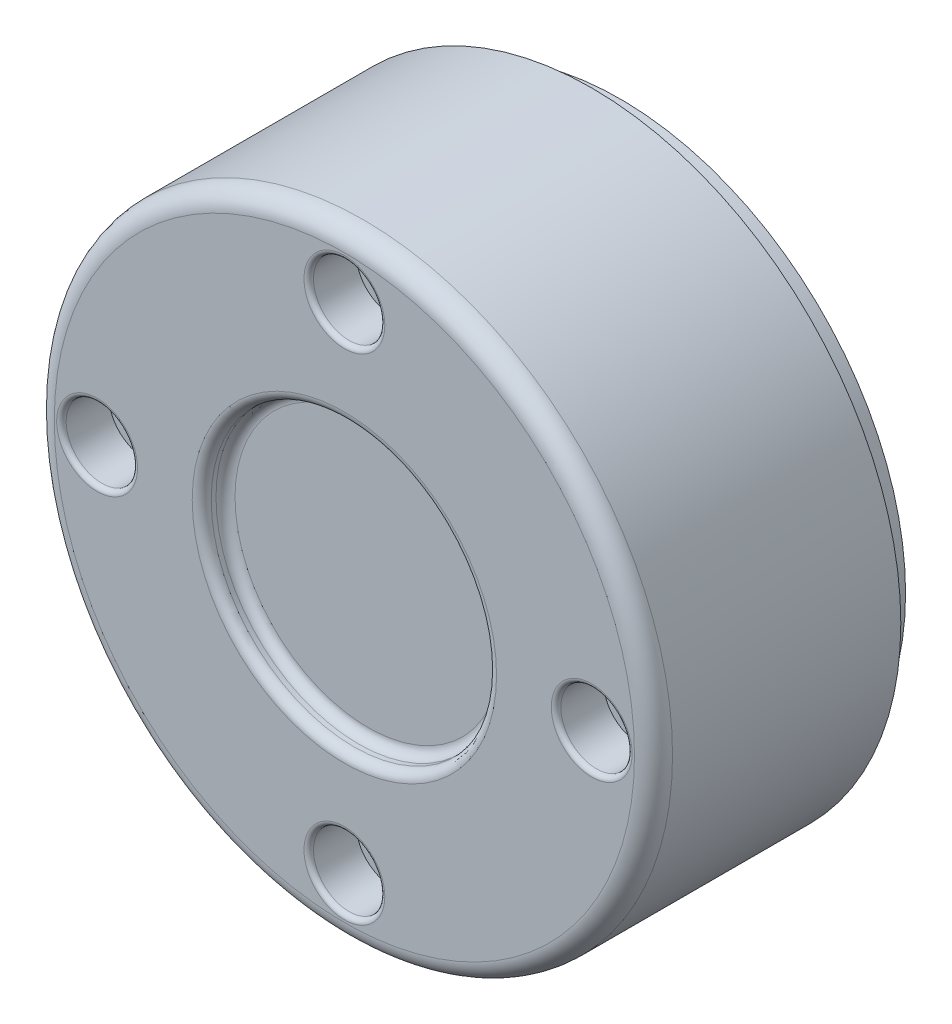
from build123d import *

# Parameters (mm, degrees)
SKETCH2_R           = 30
BOSS_EXTRUDE1_DEPTH = 3
SKETCH3_R           = 32.5
BOSS_EXTRUDE2_DEPTH = 26
SKETCH4_R           = 15
CUT_EXTRUDE1_DEPTH  = 2.5
SKETCH4_3_R         = 3.75
CUT_EXTRUDE2_DEPTH  = 5
FILLET1_R           = 1
FILLET2_R           = 1
FILLET3_R           = 2
FILLET4_R           = 0.5
SHELL1_OUTLINE_R    = 27.5
SHELL1_DEPTH        = 21.5
SHELL1_START        = 5.5
SHELL1_2_DEPTH      = 18.5
SHELL1_3_DEPTH      = 16
SHELL1_START_2      = 24
SHELL1_4_DEPTH      = 2.5
SHELL1_6_OUTLINE_R  = 17.354101966
SHELL1_6_DEPTH      = 2.5


with BuildPart() as part:
    # Sketch2 → Boss-Extrude1 (new body)
    with BuildSketch(Plane.XY):
        Circle(SKETCH2_R)
    extrude(amount=BOSS_EXTRUDE1_DEPTH)

    # Sketch3 → Boss-Extrude2 (add)
    with BuildSketch(Plane.XY.offset(3)):
        with Locations(Location((0, 0, 0), (0, 0, 180))):
            Circle(SKETCH3_R)
    extrude(amount=BOSS_EXTRUDE2_DEPTH)

    # Sketch4 → Cut-Extrude1 (cut)
    with BuildSketch(Plane.XY.offset(29)):
        Circle(SKETCH4_R)
    extrude(amount=-CUT_EXTRUDE1_DEPTH, mode=Mode.SUBTRACT)

    # Sketch4<3> → Cut-Extrude2 (cut)
    with BuildSketch(Plane.XY.offset(29)):
        with Locations((0, 26)):
            Circle(SKETCH4_3_R)
        with Locations((26, 0)):
            Circle(SKETCH4_3_R)
        with Locations((0, -26)):
            Circle(SKETCH4_3_R)
        with Locations((-26, 0)):
            Circle(SKETCH4_3_R)
    extrude(amount=-CUT_EXTRUDE2_DEPTH, mode=Mode.SUBTRACT)

    # Fillet1
    fillet1_edges = [part.edges().sort_by_distance(p)[0] for p in [
        (-15, 0, 26.5),
    ]]
    fillet(fillet1_edges, radius=FILLET1_R)

    # Fillet2
    fillet2_edges = [part.edges().sort_by_distance(p)[0] for p in [
        (-15, 0, 29),
    ]]
    fillet(fillet2_edges, radius=FILLET2_R)

    # Fillet3
    fillet3_edges = [part.edges().sort_by_distance(p)[0] for p in [
        (32.5, 0, 29),
    ]]
    fillet(fillet3_edges, radius=FILLET3_R)

    # Fillet4
    fillet4_edges = [part.edges().sort_by_distance(p)[0] for p in [
        (-29.75, 0, 29),
        (-3.75, 26, 29),
        (22.25, 0, 29),
        (-3.75, -26, 29),
    ]]
    fillet(fillet4_edges, radius=FILLET4_R)

    # Shell1: read off the stored shape, not the designer's step
    # Shell1 outline → Shell1 (cut)
    with BuildSketch(Plane.XY):
        Circle(SHELL1_OUTLINE_R)
    extrude(amount=SHELL1_DEPTH, mode=Mode.SUBTRACT)

    # Shell1 2 outline → Shell1 2 (cut)
    with BuildSketch(Plane.XY.offset(SHELL1_START)):
        with BuildLine():
            ThreePointArc((29.556490385, 5.139443175), (21.213203436, 21.213203436), (5.139443175, 29.556490385))
            ThreePointArc((5.139443175, 29.556490385), (0, 19.75), (-5.139443175, 29.556490385))
            ThreePointArc((-5.139443175, 29.556490385), (-21.213203436, 21.213203436), (-29.556490385, 5.139443175))
            ThreePointArc((-29.556490385, 5.139443175), (-19.75, 0), (-29.556490385, -5.139443175))
            ThreePointArc((-29.556490385, -5.139443175), (-21.213203436, -21.213203436), (-5.139443175, -29.556490385))
            ThreePointArc((-5.139443175, -29.556490385), (0, -19.75), (5.139443175, -29.556490385))
            ThreePointArc((5.139443175, -29.556490385), (21.213203436, -21.213203436), (29.556490385, -5.139443175))
            ThreePointArc((29.556490385, -5.139443175), (19.75, 0), (29.556490385, 5.139443175))
        make_face()
    extrude(amount=SHELL1_2_DEPTH, mode=Mode.SUBTRACT)

    # Shell1 3 outline → Shell1 3 (cut)
    with BuildSketch(Plane.XY.offset(SHELL1_START)):
        with BuildLine():
            ThreePointArc((29.556490385, -5.139443175), (30, 0), (29.556490385, 5.139443175))
            ThreePointArc((29.556490385, 5.139443175), (28.237962341, 5.835582624), (26.792067308, 6.199607196))
            ThreePointArc((26.792067308, 6.199607196), (27.5, 0), (26.792067308, -6.199607196))
            ThreePointArc((26.792067308, -6.199607196), (28.237962341, -5.835582624), (29.556490385, -5.139443175))
        make_face()
        with BuildLine():
            ThreePointArc((6.199607196, 26.792067308), (5.835582624, 28.237962341), (5.139443175, 29.556490385))
            ThreePointArc((5.139443175, 29.556490385), (0, 30), (-5.139443175, 29.556490385))
            ThreePointArc((-5.139443175, 29.556490385), (-5.835582624, 28.237962341), (-6.199607196, 26.792067308))
            ThreePointArc((-6.199607196, 26.792067308), (0, 27.5), (6.199607196, 26.792067308))
        make_face()
        with BuildLine():
            ThreePointArc((-5.139443175, -29.556490385), (0, -30), (5.139443175, -29.556490385))
            ThreePointArc((5.139443175, -29.556490385), (5.835582624, -28.237962341), (6.199607196, -26.792067308))
            ThreePointArc((6.199607196, -26.792067308), (0, -27.5), (-6.199607196, -26.792067308))
            ThreePointArc((-6.199607196, -26.792067308), (-5.835582624, -28.237962341), (-5.139443175, -29.556490385))
        make_face()
        with BuildLine():
            ThreePointArc((-26.792067308, 6.199607196), (-28.237962341, 5.835582624), (-29.556490385, 5.139443175))
            ThreePointArc((-29.556490385, 5.139443175), (-30, 0), (-29.556490385, -5.139443175))
            ThreePointArc((-29.556490385, -5.139443175), (-28.237962341, -5.835582624), (-26.792067308, -6.199607196))
            ThreePointArc((-26.792067308, -6.199607196), (-27.5, 0), (-26.792067308, 6.199607196))
        make_face()
    extrude(amount=SHELL1_3_DEPTH, mode=Mode.SUBTRACT)

    # Shell1 4 outline → Shell1 4 (cut)
    with BuildSketch(Plane.XY.offset(SHELL1_START_2)):
        with BuildLine():
            ThreePointArc((26.792067308, 6.199607196), (28.237962341, 5.835582624), (29.556490385, 5.139443175))
            ThreePointArc((29.556490385, 5.139443175), (21.213203436, 21.213203436), (5.139443175, 29.556490385))
            ThreePointArc((5.139443175, 29.556490385), (5.835582624, 28.237962341), (6.199607196, 26.792067308))
            ThreePointArc((6.199607196, 26.792067308), (19.445436483, 19.445436483), (26.792067308, 6.199607196))
        make_face()
        with BuildLine():
            ThreePointArc((5.139443175, -29.556490385), (21.213203436, -21.213203436), (29.556490385, -5.139443175))
            ThreePointArc((29.556490385, -5.139443175), (28.237962341, -5.835582624), (26.792067308, -6.199607196))
            ThreePointArc((26.792067308, -6.199607196), (19.445436483, -19.445436483), (6.199607196, -26.792067308))
            ThreePointArc((6.199607196, -26.792067308), (5.835582624, -28.237962341), (5.139443175, -29.556490385))
        make_face()
        with BuildLine():
            ThreePointArc((-6.199607196, 26.792067308), (-5.835582624, 28.237962341), (-5.139443175, 29.556490385))
            ThreePointArc((-5.139443175, 29.556490385), (-21.213203436, 21.213203436), (-29.556490385, 5.139443175))
            ThreePointArc((-29.556490385, 5.139443175), (-28.237962341, 5.835582624), (-26.792067308, 6.199607196))
            ThreePointArc((-26.792067308, 6.199607196), (-19.445436483, 19.445436483), (-6.199607196, 26.792067308))
        make_face()
        with BuildLine():
            ThreePointArc((-29.556490385, -5.139443175), (-21.213203436, -21.213203436), (-5.139443175, -29.556490385))
            ThreePointArc((-5.139443175, -29.556490385), (-5.835582624, -28.237962341), (-6.199607196, -26.792067308))
            ThreePointArc((-6.199607196, -26.792067308), (-19.445436483, -19.445436483), (-26.792067308, -6.199607196))
            ThreePointArc((-26.792067308, -6.199607196), (-28.237962341, -5.835582624), (-29.556490385, -5.139443175))
        make_face()
    extrude(amount=SHELL1_4_DEPTH, mode=Mode.SUBTRACT)

    # Shell1 5 outline → Shell1 5 (revolve, cut)
    with BuildSketch(Plane.XZ):
        with BuildLine():
            ThreePointArc((17.354101966, 26.5), (16.091650066, 24.69375696), (14, 24))
            Line((14, 24), (17.354101966, 24))
            Line((17.354101966, 24), (17.354101966, 26.5))
        make_face()
    revolve(axis=Axis((0, 0, 0), (0, 0, 1)), mode=Mode.SUBTRACT)

    # Shell1 6 outline → Shell1 6 (cut)
    with BuildSketch(Plane.XY.offset(SHELL1_START_2)):
        with BuildLine():
            ThreePointArc((-26.792067308, 6.199607196), (-19.75, 0), (-26.792067308, -6.199607196))
            ThreePointArc((-26.792067308, -6.199607196), (-19.445436483, -19.445436483), (-6.199607196, -26.792067308))
            ThreePointArc((-6.199607196, -26.792067308), (0, -19.75), (6.199607196, -26.792067308))
            ThreePointArc((6.199607196, -26.792067308), (19.445436483, -19.445436483), (26.792067308, -6.199607196))
            ThreePointArc((26.792067308, -6.199607196), (19.75, 0), (26.792067308, 6.199607196))
            ThreePointArc((26.792067308, 6.199607196), (19.445436483, 19.445436483), (6.199607196, 26.792067308))
            ThreePointArc((6.199607196, 26.792067308), (0, 19.75), (-6.199607196, 26.792067308))
            ThreePointArc((-6.199607196, 26.792067308), (-19.445436483, 19.445436483), (-26.792067308, 6.199607196))
        make_face()
        Circle(SHELL1_6_OUTLINE_R, mode=Mode.SUBTRACT)
    extrude(amount=SHELL1_6_DEPTH, mode=Mode.SUBTRACT)


solid = part.part
